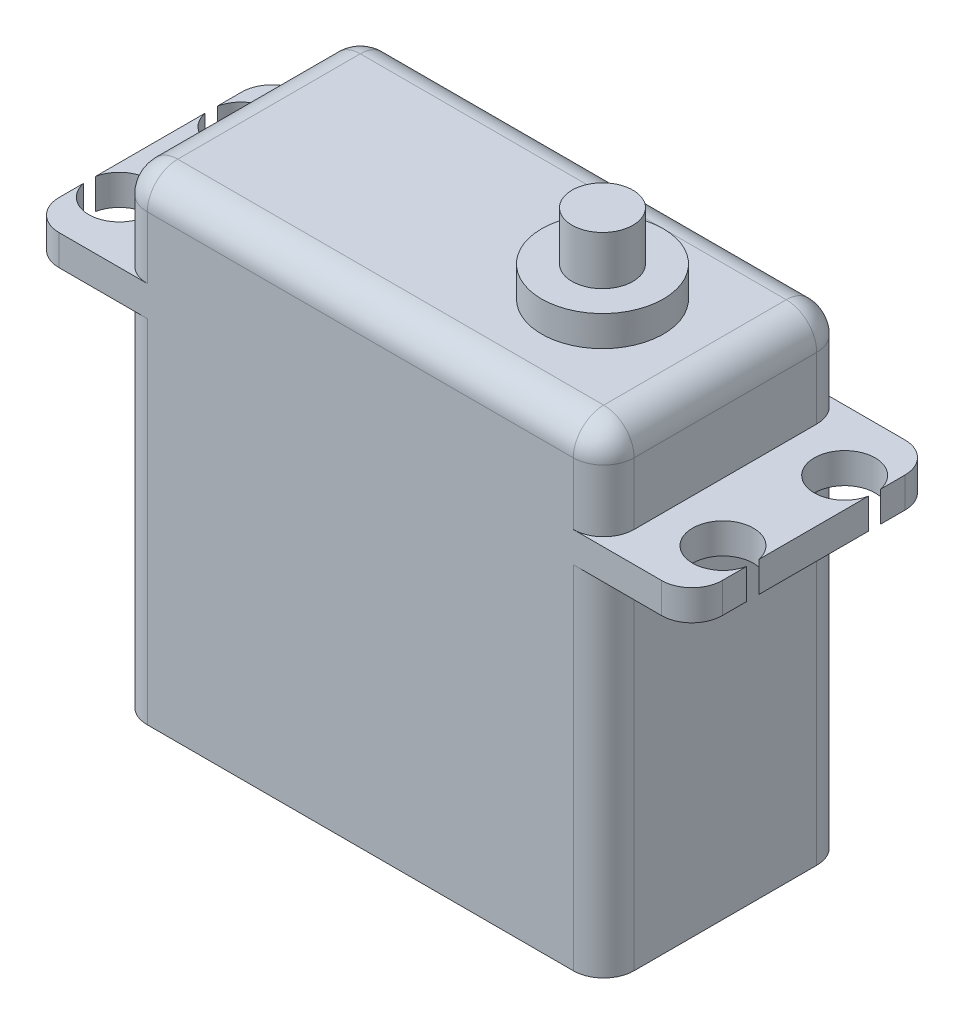
from build123d import *

# Parameters (mm, degrees)
SKETCH1_W           = 40
SKETCH1_H           = 20
BOSS_EXTRUDE1_DEPTH = 39
BOSS_EXTRUDE2_DEPTH = 2.5
FILLET1_R           = 2.5
SKETCH3_R           = 5
BOSS_EXTRUDE3_DEPTH = 2.5
SKETCH4_R           = 2.5
BOSS_EXTRUDE4_DEPTH = 4
FILLET2_R           = 2.5
FILLET3_R           = 2.5


with BuildPart() as part:
    # Sketch1 → Boss-Extrude1 (new body)
    with BuildSketch(Plane(origin=(0, 0, 0), x_dir=(1, 0, 0), z_dir=(0, 1, 0))):
        with Locations((20, 10)):
            Rectangle(SKETCH1_W, SKETCH1_H)
    extrude(amount=BOSS_EXTRUDE1_DEPTH)

    # Sketch2 → Boss-Extrude2 (add)
    with BuildSketch(Plane(origin=(0, 28.9, 0), x_dir=(-1, 0, 0), z_dir=(0, -1, 0))):
        with BuildLine():
            ThreePointArc((-44.8, 12.5), (-46.382129215, 13.064317395), (-47.25, 14.502506281))
            Line((-47.25, 14.502506281), (-47.25, 5.497493719))
            ThreePointArc((-47.25, 5.497493719), (-46.382129215, 6.935682605), (-44.8, 7.5))
            Line((-44.8, 7.5), (-44.8, 12.5))
        make_face()
        with BuildLine():
            Line((7.25, 20), (-47.25, 20))
            Line((-47.25, 20), (-47.25, 15.497493719))
            ThreePointArc((-47.25, 15.497493719), (-44.55, 17.487468593), (-42.3, 15))
            ThreePointArc((-42.3, 15), (-43.032233047, 13.232233047), (-44.8, 12.5))
            Line((-44.8, 12.5), (-44.8, 7.5))
            ThreePointArc((-44.8, 7.5), (-43.032233047, 6.767766953), (-42.3, 5))
            ThreePointArc((-42.3, 5), (-44.55, 2.512531407), (-47.25, 4.502506281))
            Line((-47.25, 4.502506281), (-47.25, 0))
            Line((-47.25, 0), (7.25, 0))
            Line((7.25, 0), (7.25, 4.502506281))
            ThreePointArc((7.25, 4.502506281), (2.3, 5), (7.25, 5.497493719))
            Line((7.25, 5.497493719), (7.25, 14.502506281))
            ThreePointArc((7.25, 14.502506281), (2.3, 15), (7.25, 15.497493719))
            Line((7.25, 15.497493719), (7.25, 20))
        make_face()
    extrude(amount=-BOSS_EXTRUDE2_DEPTH)

    # Fillet1
    fillet1_edges = [part.edges().sort_by_distance(p)[0] for p in [
        (47.25, 30.15, -20),
        (-7.25, 30.15, 0),
        (-7.25, 30.15, -20),
        (47.25, 30.15, 0),
    ]]
    fillet(fillet1_edges, radius=FILLET1_R)

    # Sketch3 → Boss-Extrude3 (add)
    with BuildSketch(Plane(origin=(0, 39, 0), x_dir=(1, 0, 0), z_dir=(0, 1, 0))):
        with Locations(Location((29.9, 10, 0), (0, 0, 90))):
            Circle(SKETCH3_R)
    extrude(amount=BOSS_EXTRUDE3_DEPTH)

    # Sketch4 → Boss-Extrude4 (add)
    with BuildSketch(Plane(origin=(0, 41.5, 0), x_dir=(1, 0, 0), z_dir=(0, 1, 0))):
        with Locations(Location((29.9, 10, 0), (0, 0, 270))):
            Circle(SKETCH4_R)
    extrude(amount=BOSS_EXTRUDE4_DEPTH)

    # Fillet2
    fillet2_edges = [part.edges().sort_by_distance(p)[0] for p in [
        (0, 14.45, -20),
        (40, 14.45, -20),
        (40, 14.45, 0),
        (20, 39, -20),
        (0, 14.45, 0),
        (0, 35.2, -20),
        (40, 35.2, -20),
        (40, 35.2, 0),
        (0, 35.2, 0),
        (20, 39, 0),
    ]]
    fillet(fillet2_edges, radius=FILLET2_R)

    # Fillet3
    # the kernel refuses this fillet: 2.5 mm, written as the material it takes off along each edge
    with BuildSketch(Plane(origin=(2.5, 36.5, -2.5), x_dir=(0, 1, 0), z_dir=(-1, 0, 0))) as fillet3_piece_1_section:
        Polygon((0, 0), (FILLET3_R, 0), (FILLET3_R, -FILLET3_R), (0, -FILLET3_R), align=None)
    fillet3_piece_1 = extrude(amount=FILLET3_R, mode=Mode.PRIVATE)
    fillet3_piece_1 = fillet3_piece_1 - Plane(origin=(2.5, 36.5, -2.5), x_dir=(0, -0.7071067811865475, -0.7071067811865475), z_dir=(-1, 0, 0)) * Sphere(FILLET3_R, mode=Mode.PRIVATE)
    add(fillet3_piece_1, mode=Mode.SUBTRACT)
    with BuildSketch(Plane(origin=(37.5, 36.5, -2.5), x_dir=(1, 0, 0), z_dir=(0, 1, 0))) as fillet3_piece_2_section:
        Polygon((0, 0), (FILLET3_R, 0), (FILLET3_R, -FILLET3_R), (0, -FILLET3_R), align=None)
    fillet3_piece_2 = extrude(amount=FILLET3_R, mode=Mode.PRIVATE)
    fillet3_piece_2 = fillet3_piece_2 - Plane(origin=(37.5, 36.5, -2.5), x_dir=(-0.7071067811865475, 0, -0.7071067811865475), z_dir=(0, 1, 0)) * Sphere(FILLET3_R, mode=Mode.PRIVATE)
    add(fillet3_piece_2, mode=Mode.SUBTRACT)
    with BuildSketch(Plane(origin=(37.5, 36.5, -17.5), x_dir=(1, 0, 0), z_dir=(0, 1, 0))) as fillet3_piece_3_section:
        Polygon((0, 0), (FILLET3_R, 0), (FILLET3_R, FILLET3_R), (0, FILLET3_R), align=None)
    fillet3_piece_3 = extrude(amount=FILLET3_R, mode=Mode.PRIVATE)
    fillet3_piece_3 = fillet3_piece_3 - Plane(origin=(37.5, 36.5, -17.5), x_dir=(-0.7071067811865475, 0, 0.7071067811865475), z_dir=(0, 1, 0)) * Sphere(FILLET3_R, mode=Mode.PRIVATE)
    add(fillet3_piece_3, mode=Mode.SUBTRACT)
    with BuildSketch(Plane(origin=(2.5, 36.5, -17.5), x_dir=(0, 1, 0), z_dir=(-1, 0, 0))) as fillet3_piece_4_section:
        Polygon((0, 0), (FILLET3_R, 0), (FILLET3_R, FILLET3_R), (0, FILLET3_R), align=None)
    fillet3_piece_4 = extrude(amount=FILLET3_R, mode=Mode.PRIVATE)
    fillet3_piece_4 = fillet3_piece_4 - Plane(origin=(2.5, 36.5, -17.5), x_dir=(0, -0.7071067811865475, 0.7071067811865475), z_dir=(-1, 0, 0)) * Sphere(FILLET3_R, mode=Mode.PRIVATE)
    add(fillet3_piece_4, mode=Mode.SUBTRACT)
    with BuildSketch(Plane(origin=(0, 39, -17.5), x_dir=(0, -1, 0), z_dir=(0, 0, 1))) as fillet3_piece_5:
        with BuildLine():
            CenterArc((FILLET3_R, FILLET3_R), FILLET3_R, 180, 90)
            Line((0, FILLET3_R), (0, 0))
            Line((0, 0), (FILLET3_R, 0))
        make_face()
    extrude(amount=15, mode=Mode.SUBTRACT)
    with BuildSketch(Plane(origin=(40, 39, -2.5), x_dir=(-1, 0, 0), z_dir=(0, 0, -1))) as fillet3_piece_6:
        with BuildLine():
            CenterArc((FILLET3_R, -FILLET3_R), FILLET3_R, 90, 90)
            Line((0, -FILLET3_R), (0, 0))
            Line((0, 0), (FILLET3_R, 0))
        make_face()
    extrude(amount=15, mode=Mode.SUBTRACT)


solid = part.part
